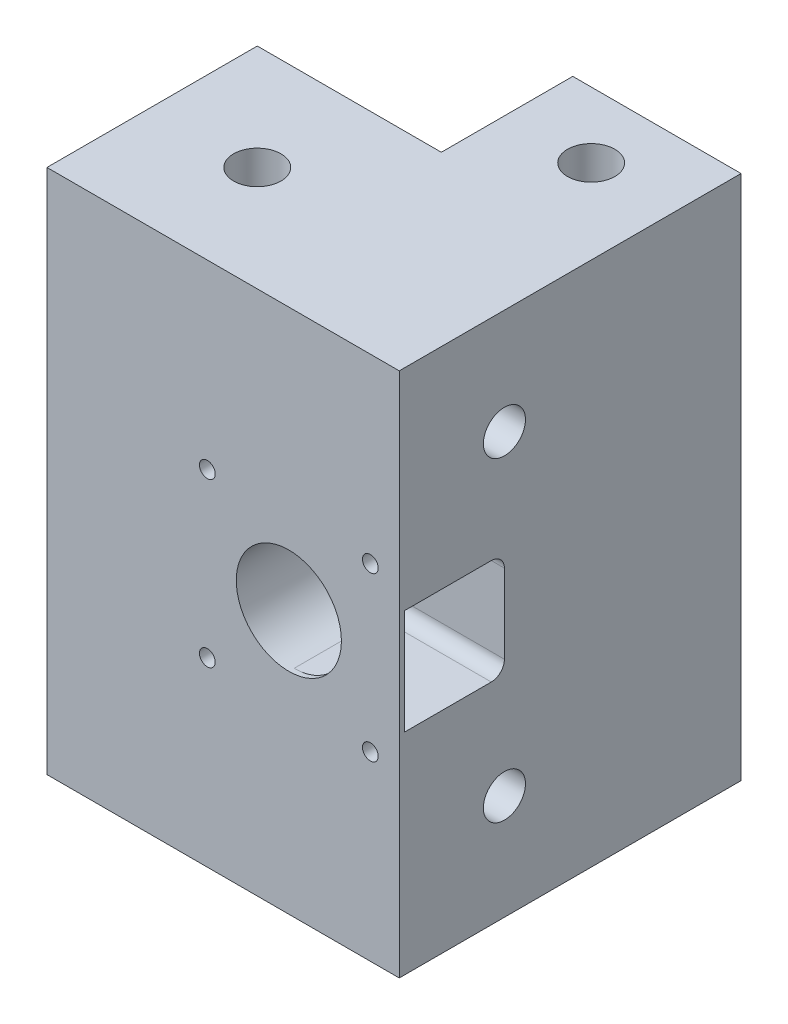
from build123d import *

# Parameters (mm, degrees)
SKETCH1_R                               = 4.5
BOSS_EXTRUDE1_DEPTH                     = 100
CBORE_FOR_M5_HEX_HEAD_BOLT2_D           = 13.5
CBORE_FOR_M5_HEX_HEAD_BOLT2_DEPTH       = 23.85
CBORE_FOR_M5_HEX_HEAD_BOLT2_CBORE_D     = 32
CBORE_FOR_M5_HEX_HEAD_BOLT2_CBORE_DEPTH = 5
CBORE_FOR_M5_HEX_HEAD_BOLT3_D           = 10.2
CBORE_FOR_M5_HEX_HEAD_BOLT3_DEPTH       = 13.5
CBORE_FOR_M5_HEX_HEAD_BOLT3_CBORE_D     = 22
CBORE_FOR_M5_HEX_HEAD_BOLT3_CBORE_DEPTH = 3.5
SKETCH8_R                               = 4
CUT_EXTRUDE1_DEPTH                      = 27
SKETCH9_R                               = 1.5
CUT_EXTRUDE2_DEPTH                      = 119
SKETCH10_R                              = 10
CUT_EXTRUDE3_DEPTH                      = 20
SKETCH11_W                              = 19
SKETCH11_H                              = 20
CUT_EXTRUDE4_DEPTH                      = 21
FILLET2_R                               = 2.5


with BuildPart() as part:
    # Sketch1 → Boss-Extrude1 (new body)
    with BuildSketch(Plane(origin=(0, 0, 0), x_dir=(1, 0, 0), z_dir=(0, 1, 0))):
        Polygon((-35, 0), (0, 0), (0, 25), (32, 25), (32, -40), (-35, -40), align=None)
        with Locations((-15, -20)):
            Circle(SKETCH1_R, mode=Mode.SUBTRACT)
        with Locations((16, 12.5)):
            Circle(SKETCH1_R, mode=Mode.SUBTRACT)
    extrude(amount=BOSS_EXTRUDE1_DEPTH)

    # CBORE for M5 Hex Head Bolt2
    with Locations(Plane(origin=(0, 0, 0), x_dir=(-1, 0, 0), z_dir=(0, -1, 0))):
        with Locations((15, -20)):
            CounterBoreHole(CBORE_FOR_M5_HEX_HEAD_BOLT2_D / 2, CBORE_FOR_M5_HEX_HEAD_BOLT2_CBORE_D / 2, CBORE_FOR_M5_HEX_HEAD_BOLT2_CBORE_DEPTH, depth=CBORE_FOR_M5_HEX_HEAD_BOLT2_DEPTH)

    # CBORE for M5 Hex Head Bolt3
    with Locations(Plane(origin=(0, 0, 0), x_dir=(-1, 0, 0), z_dir=(0, -1, 0))):
        with Locations((-16, 12.5)):
            CounterBoreHole(CBORE_FOR_M5_HEX_HEAD_BOLT3_D / 2, CBORE_FOR_M5_HEX_HEAD_BOLT3_CBORE_D / 2, CBORE_FOR_M5_HEX_HEAD_BOLT3_CBORE_DEPTH, depth=CBORE_FOR_M5_HEX_HEAD_BOLT3_DEPTH)

    # Sketch8 → Cut-Extrude1 (cut)
    with BuildSketch(Plane(origin=(32, 0, 0), x_dir=(0, 0, -1), z_dir=(1, 0, 0))):
        with Locations((-20, 80)):
            Circle(SKETCH8_R)
        with Locations((-20, 20)):
            Circle(SKETCH8_R)
    extrude(amount=-CUT_EXTRUDE1_DEPTH, mode=Mode.SUBTRACT)

    # Sketch9 → Cut-Extrude2 (cut)
    with BuildSketch(Plane.XY.offset(40)):
        with Locations((-4.5, 65.5)):
            Circle(SKETCH9_R)
        with Locations((26.5, 65.5)):
            Circle(SKETCH9_R)
        with Locations((26.5, 34.5)):
            Circle(SKETCH9_R)
        with Locations((-4.5, 34.5)):
            Circle(SKETCH9_R)
    extrude(amount=-CUT_EXTRUDE2_DEPTH, mode=Mode.SUBTRACT)

    # Sketch10 → Cut-Extrude3 (cut)
    with BuildSketch(Plane.XY.offset(40)):
        with Locations((11, 50)):
            Circle(SKETCH10_R)
    extrude(amount=-CUT_EXTRUDE3_DEPTH, mode=Mode.SUBTRACT)

    # Sketch11 → Cut-Extrude4 (cut)
    with BuildSketch(Plane(origin=(32, 0, 0), x_dir=(0, 0, -1), z_dir=(1, 0, 0))):
        with Locations((-29.5, 50)):
            Rectangle(SKETCH11_W, SKETCH11_H)
    extrude(amount=-CUT_EXTRUDE4_DEPTH, mode=Mode.SUBTRACT)

    # Fillet2
    fillet2_edges = [part.edges().sort_by_distance(p)[0] for p in [
        (21.5, 40, 20),
        (1, 50, 20),
        (21.5, 60, 20),
    ]]
    fillet(fillet2_edges, radius=FILLET2_R)


solid = part.part
